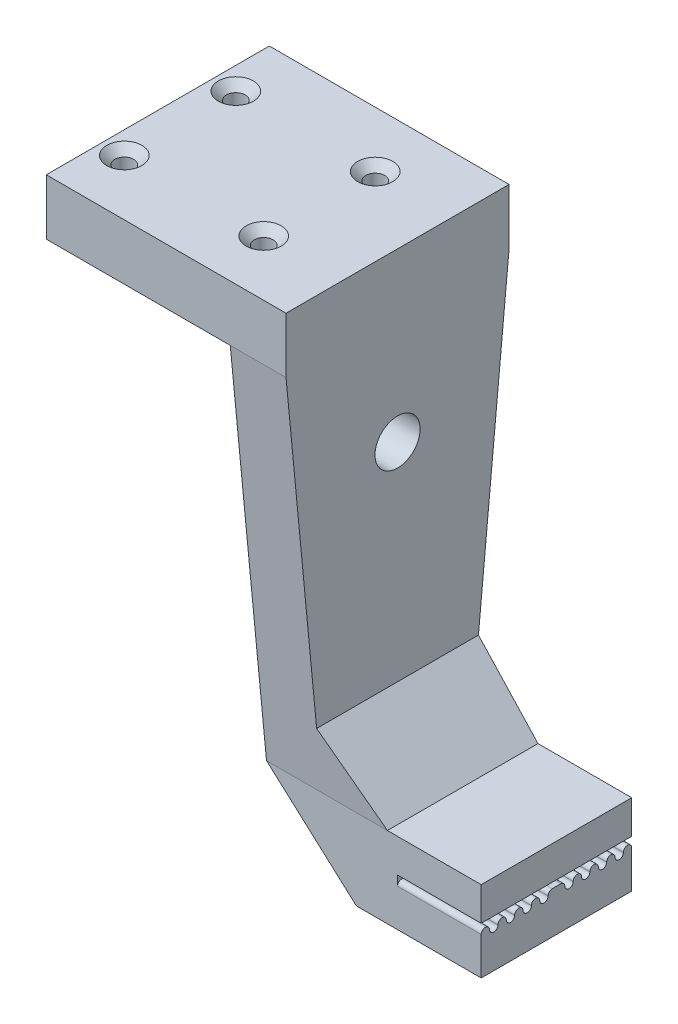
from build123d import *

# Parameters (mm, degrees)
SKETCH_1_W                   = 33
SKETCH_1_H                   = 40
EXTRUDE_1_DEPTH              = 10
EXTRUDE_2_DEPTH              = 10
SKETCH_3_W                   = 27
SKETCH_3_H                   = 14.5
EXTRUDE_3_DEPTH              = 28.5
CUT_EXTRUDE_1_DEPTH          = 15
CUT_EXTRUDE_2_REACH          = 116.016
EXTRUDE_4_REACH              = 116.016
EXTRUDE_5_REACH              = 116.016
HOLE_WIZARD_M3_1_D           = 3.4
HOLE_WIZARD_M3_1_CSINK_D     = 6.3
HOLE_WIZARD_M3_1_CSINK_ANGLE = 90
OTHER_START                  = 35
OTHER_1_OUTLINE_R            = 4.05
OTHER_1_DEPTH                = 8


# Read off the part's stored shape, not the designer's step: 高级异型孔1
with BuildPart() as part:
    # 草图1 → 凸台-拉伸1 (new body)
    with BuildSketch(Plane(origin=(0, 0, 0), x_dir=(1, 0, 0), z_dir=(0, 1, 0))):
        with Locations((16.5, 20)):
            Rectangle(SKETCH_1_W, SKETCH_1_H)
    extrude(amount=EXTRUDE_1_DEPTH)

    # 草图2 → 凸台-拉伸2 (add)
    with BuildSketch(Plane(origin=(33, 0, 0), x_dir=(0, 0, -1), z_dir=(1, 0, 0))):
        Polygon((0, 0), (6.5, -67.75), (6.5, -82.25), (33.5, -82.25), (33.5, -67.75), (40, 0), (40, 10), (0, 10), align=None)
    extrude(amount=EXTRUDE_2_DEPTH)

    # 草图3 → 凸台-拉伸3 (add)
    with BuildSketch(Plane(origin=(43, 0, 0), x_dir=(0, 0, -1), z_dir=(1, 0, 0))):
        with Locations((20, -75)):
            Rectangle(SKETCH_3_W, SKETCH_3_H)
    extrude(amount=EXTRUDE_3_DEPTH)

    # 草图4 → 切除-拉伸1 (cut)
    with BuildSketch(Plane.ZY.offset(-71.5)):
        with BuildLine():
            Line((-6.5, -75.5), (-6.5, -73.75))
            Line((-6.5, -73.75), (-33.5, -73.75))
            Line((-33.5, -73.75), (-33.5, -75.5))
            ThreePointArc((-33.5, -75.5), (-32.75, -74.75), (-32, -75.5))
            ThreePointArc((-32, -75.5), (-31.25, -76.25), (-30.5, -75.5))
            ThreePointArc((-30.5, -75.5), (-29.75, -74.75), (-29, -75.5))
            ThreePointArc((-29, -75.5), (-28.25, -76.25), (-27.5, -75.5))
            ThreePointArc((-27.5, -75.5), (-26.75, -74.75), (-26, -75.5))
            ThreePointArc((-26, -75.5), (-25.25, -76.25), (-24.5, -75.5))
            ThreePointArc((-24.5, -75.5), (-23.75, -74.75), (-23, -75.5))
            ThreePointArc((-23, -75.5), (-22.25, -76.25), (-21.5, -75.5))
            ThreePointArc((-21.5, -75.5), (-21.280330086, -74.969669914), (-20.75, -74.75))
            Line((-20.75, -74.75), (-19.25, -74.75))
            ThreePointArc((-19.25, -74.75), (-18.719669914, -74.969669914), (-18.5, -75.5))
            ThreePointArc((-18.5, -75.5), (-17.75, -76.25), (-17, -75.5))
            ThreePointArc((-17, -75.5), (-16.25, -74.75), (-15.5, -75.5))
            ThreePointArc((-15.5, -75.5), (-14.75, -76.25), (-14, -75.5))
            ThreePointArc((-14, -75.5), (-13.25, -74.75), (-12.5, -75.5))
            ThreePointArc((-12.5, -75.5), (-11.75, -76.25), (-11, -75.5))
            ThreePointArc((-11, -75.5), (-10.25, -74.75), (-9.5, -75.5))
            ThreePointArc((-9.5, -75.5), (-8.75, -76.25), (-8, -75.5))
            ThreePointArc((-8, -75.5), (-7.25, -74.75), (-6.5, -75.5))
        make_face()
    extrude(amount=CUT_EXTRUDE_1_DEPTH, mode=Mode.SUBTRACT)

    # 草图5 → 切除-拉伸2 (cut, up to next)
    with BuildSketch(Plane.XY.offset(-6.5), mode=Mode.PRIVATE) as cut_extrude_2_sk1:
        Polygon((33, -82.25), (49.121822718, -82.25), (33, -67.75), align=None)
    cut_extrude_2_tool1 = extrude(cut_extrude_2_sk1.sketch, amount=-CUT_EXTRUDE_2_REACH, mode=Mode.PRIVATE) & part.part
    add(cut_extrude_2_tool1.solids().sort_by_distance((38.373941, -77.416667, -6.5))[0], mode=Mode.SUBTRACT)

    # 凸台-拉伸4: up to this plane
    extrude_4_end = Plane(origin=(43, -67.75, -33.5), z_dir=(0, 0.09550243214662471, 0.9954291966052028))
    # 草图6 → 凸台-拉伸4 (add, up to the surface)
    with BuildSketch(Plane.XY.offset(-6.5), mode=Mode.PRIVATE) as extrude_4_sk1:
        Polygon((43, -57.242064668), (43, -67.75), (54.683246246, -67.75), align=None)
    extrude_4_tool1 = split(extrude(extrude_4_sk1.sketch, amount=-EXTRUDE_4_REACH, mode=Mode.PRIVATE), bisect_by=extrude_4_end, keep=Keep.BOTH, mode=Mode.PRIVATE)
    add(extrude_4_tool1.solids().sort_by_distance((46.894415, -64.247355, -6.5))[0])

    # 凸台-拉伸5: up to this face of the body (flat: up to its plane)
    extrude_5_end = Plane(part.part.faces().sort_by_distance((38, -33.875, -3.25))[0])
    # 草图6<2> → 凸台-拉伸5 (add, up to the picked face)
    with BuildSketch(Plane.XY.offset(-6.5), mode=Mode.PRIVATE) as extrude_5_sk1:
        Polygon((43, -57.242064668), (43, -67.75), (54.683246246, -67.75), align=None)
    extrude_5_tool1 = split(extrude(extrude_5_sk1.sketch, amount=EXTRUDE_5_REACH, mode=Mode.PRIVATE), bisect_by=extrude_5_end, keep=Keep.BOTH, mode=Mode.PRIVATE)
    add(extrude_5_tool1.solids().sort_by(Axis((46.894415, -64.247355, -6.5), (0, 0, 1)))[0])

    # M3 平头机械螺钉的锥形沉头孔1 (through all)
    with Locations(Plane(origin=(0, 10, 0), x_dir=(1, 0, 0), z_dir=(0, 1, 0))):
        with Locations((29, 30), (4, 30), (4, 10), (29, 10)):
            CounterSinkHole(HOLE_WIZARD_M3_1_D / 2, HOLE_WIZARD_M3_1_CSINK_D / 2, counter_sink_angle=HOLE_WIZARD_M3_1_CSINK_ANGLE)

    # 高级异型孔1 outline → 高级异型孔1 (cut)
    with BuildSketch(Plane.YZ.offset(OTHER_START)):
        with Locations((-20, -20)):
            Circle(OTHER_1_OUTLINE_R)
    extrude(amount=OTHER_1_DEPTH, mode=Mode.SUBTRACT)


solid = part.part
